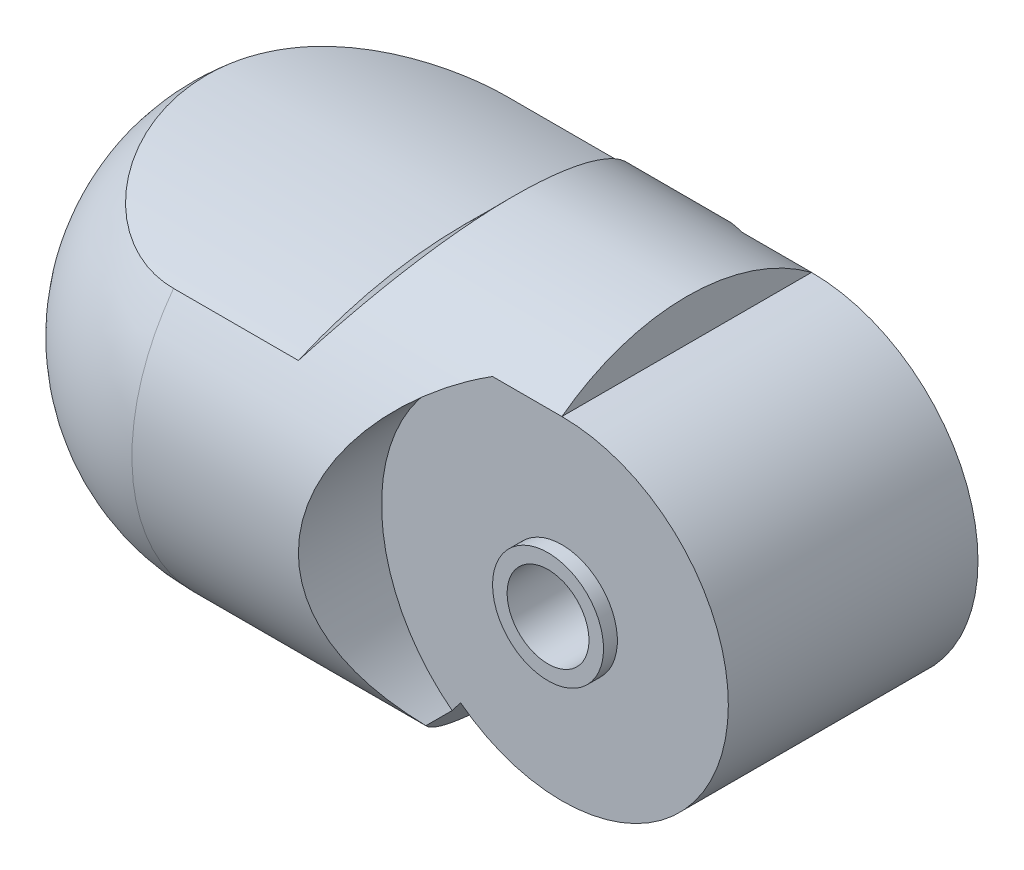
from build123d import *

# Parameters (mm, degrees)
SKETCH1_R               = 6
SKETCH1_R_2             = 1.475
BOSS_EXTRUDE1_DEPTH     = 4.5
CUT_EXTRUDE2_DEPTH      = 23.638462845
CUT_EXTRUDE2_DEPTH_BACK = 23.638462845
CUT_EXTRUDE1_START      = -6
CUT_EXTRUDE1_DEPTH      = 17.638462912
CHAMFER1_SIZE           = 2
CUT_EXTRUDE3_START      = 4.5
SKETCH9_R               = 6.5
CUT_EXTRUDE3_DEPTH      = 19.138462912
CUT_EXTRUDE4_START      = -4.5
SKETCH9_2_R             = 6.5
CUT_EXTRUDE4_DEPTH      = 19.138462913
SKETCH10_W              = 0.525
SKETCH10_H              = 0.5


with BuildPart() as part:
    # Sketch1 → Boss-Extrude1 (new, symmetric)
    with BuildSketch(Plane.XY):
        Circle(SKETCH1_R)
        Circle(SKETCH1_R_2, mode=Mode.SUBTRACT)
    extrude(amount=BOSS_EXTRUDE1_DEPTH, both=True)


with BuildPart() as body_2:
    # Sketch5 → Revolve1 (revolve)
    with BuildSketch(Plane.XY):
        with BuildLine():
            Line((0, -7.5), (-12.5, -7.5))
            ThreePointArc((-12.5, -7.5), (-17.803300859, -5.303300859), (-20, 0))
            Line((-20, 0), (0, 0))
            Line((0, 0), (0, -7.5))
        make_face()
    revolve(axis=Axis((-26.625188219, 0, 0), (1, 0, 0)))

    # Sketch7 → Cut-Extrude2 (cut, two sides: drawn at the far end of the back side and taken through both)
    with BuildSketch(Plane.XY.offset(-CUT_EXTRUDE2_DEPTH_BACK)):
        with BuildLine():
            Line((-3.652568574, -4.760120042), (-5.75495241, -7.5))
            Line((-5.75495241, -7.5), (0, -7.5))
            Line((0, -7.5), (0, -6))
            ThreePointArc((0, -6), (1.928636792, 5.681580777), (-3.652568574, -4.760120042))
        make_face()
    extrude(amount=CUT_EXTRUDE2_DEPTH + CUT_EXTRUDE2_DEPTH_BACK, mode=Mode.SUBTRACT)


with BuildPart() as part_1:
    add(part.part)

    # Combine1: union body 2
    add(body_2.part)

    # Sketch6 → Cut-Extrude1 (cut, through all)
    with BuildSketch(Plane(origin=(0, 0, 0), x_dir=(0, 0, -1), z_dir=(1, 0, 0)).offset(CUT_EXTRUDE1_START)):
        with BuildLine():
            ThreePointArc((-6, 4.5), (0, 5.752272915), (6, 4.5))
            ThreePointArc((6, 4.5), (0, 7.5), (-6, 4.5))
        make_face()
    extrude(amount=-CUT_EXTRUDE1_DEPTH, mode=Mode.SUBTRACT)

    # Chamfer1
    # the kernel refuses this chamfer: 2 mm, written as the material it adds along each edge
    with BuildSketch(Plane(origin=(-6, -9.247727085, 0), x_dir=(0, 0.7286512742865437, 0.6848848957895012), z_dir=(0, -0.6848848957895012, 0.7286512742865437))) as chamfer1_piece_1_section:
        Polygon((15, CHAMFER1_SIZE), (15 + CHAMFER1_SIZE, 0), (15, 0), align=None)
    chamfer1_piece_1 = revolve(axis=Axis((-6, -9.247727085, 0), (-1, 0, 0)), revolution_arc=86.453111056, mode=Mode.PRIVATE)
    chamfer1_piece_1 = chamfer1_piece_1 & Plane(origin=(-6.733016539, 0, 0), x_dir=(0, -1, 0), z_dir=(-1, 0, 0)) * Cylinder(7.5, 68, mode=Mode.PRIVATE)
    add(chamfer1_piece_1)

    # Sketch9 → Cut-Extrude3 (cut, through all)
    with BuildSketch(Plane.XY.offset(CUT_EXTRUDE3_START)):
        Circle(SKETCH9_R)
    extrude(amount=CUT_EXTRUDE3_DEPTH, mode=Mode.SUBTRACT)

    # Sketch9<2> → Cut-Extrude4 (cut, through all)
    with BuildSketch(Plane.XY.offset(CUT_EXTRUDE4_START)):
        Circle(SKETCH9_2_R)
    extrude(amount=-CUT_EXTRUDE4_DEPTH, mode=Mode.SUBTRACT)

    # Sketch10 → Revolve2 (revolve)
    with BuildSketch(Plane(origin=(0, 0, 0), x_dir=(1, 0, 0), z_dir=(0, 1, 0)), mode=Mode.PRIVATE) as revolve2_sk:
        with Locations((1.7375, 4.75)):
            Rectangle(SKETCH10_W, SKETCH10_H)
        with Locations((1.7375, -4.75)):
            Rectangle(SKETCH10_W, SKETCH10_H)
    revolve(revolve2_sk.sketch.rotate(Axis((0, 0, -4.5), (0, 0, 1)), 180), axis=Axis((0, 0, -4.5), (0, 0, 1)))


solid = part_1.part
